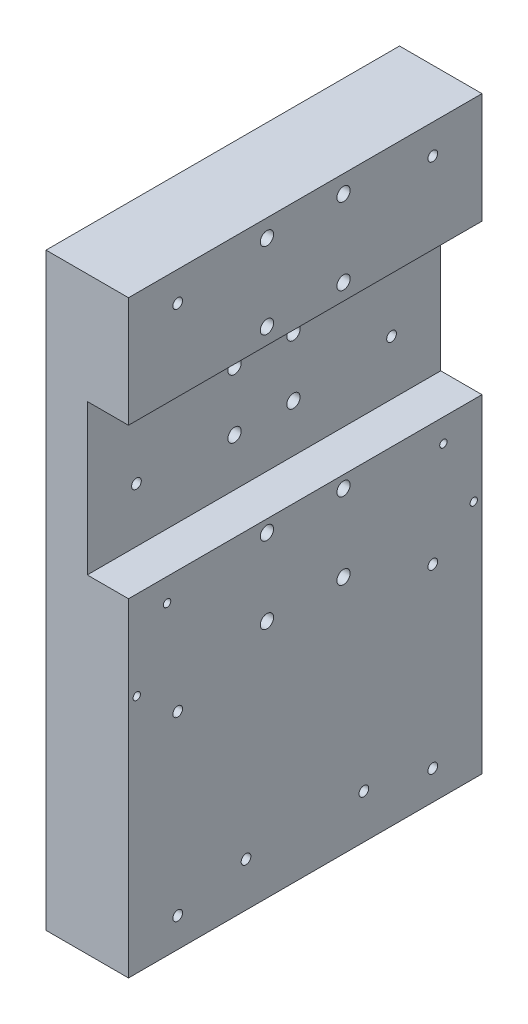
from build123d import *

# Parameters (mm, degrees)
BOSS_EXTRUDE1_DEPTH            = 120
CBORE_FOR_M4_SHCS4_D           = 4.5
CBORE_FOR_M4_SHCS4_CBORE_D     = 8
CBORE_FOR_M4_SHCS4_CBORE_DEPTH = 4
M4_TAPPED_HOLE1_D              = 3.3
M5_TAPPED_HOLE1_D              = 4.2
M5_TAPPED_HOLE1_DEPTH          = 17.4
M5_TAPPED_HOLE1_TIP            = 1.2618073
M4_TAPPED_HOLE2_D              = 3.3
M3_TAPPED_HOLE2_D              = 2.5
M3_TAPPED_HOLE2_DEPTH          = 11.5
M3_TAPPED_HOLE2_TIP            = 0.751075774


with BuildPart() as part:
    # Sketch1 → Boss-Extrude1 (new body)
    with BuildSketch(Plane.XY):
        Polygon((0, 0), (0, 200), (28, 200), (28, 162.5), (14, 162.5), (14, 111.5), (28, 111.5), (28, 0), align=None)
    extrude(amount=BOSS_EXTRUDE1_DEPTH)

    # CBORE for M4 SHCS4 (through all)
    with Locations(Plane(origin=(0, 194, 73), x_dir=(0, 0, -1), z_dir=(-1, 0, 0))):
        with Locations((0, 0), (0, 26), (3, 46.3), (3, 66.3), (0, 86.6), (0, 112.6), (26, 112.6), (26, 86.6), (23, 66.3), (23, 46.3), (26, 26), (26, 0)):
            CounterBoreHole(CBORE_FOR_M4_SHCS4_D / 2, CBORE_FOR_M4_SHCS4_CBORE_D / 2, CBORE_FOR_M4_SHCS4_CBORE_DEPTH)

    # M4 Tapped Hole1 (through all)
    with Locations(Plane(origin=(0, 190, 16.7), x_dir=(0, 0, -1), z_dir=(-1, 0, 0))):
        with Locations((0, 0), (0, 60), (0, 120), (0, 180), (-86.6, 180), (-86.6, 120), (-86.6, 60), (-86.6, 0)):
            Hole(M4_TAPPED_HOLE1_D / 2)

    # M5 Tapped Hole1
    with Locations(Plane(origin=(14, 0, 90), x_dir=(-1, 0, 0), z_dir=(0, -1, 0))):
        with Locations((0, 0), (0, 30), (0, 60)):
            Hole(M5_TAPPED_HOLE1_D / 2, depth=M5_TAPPED_HOLE1_DEPTH)
            with Locations((0, 0, -(M5_TAPPED_HOLE1_DEPTH + M5_TAPPED_HOLE1_TIP / 2))):  # 118° drill point
                Cone(0, M5_TAPPED_HOLE1_D / 2, M5_TAPPED_HOLE1_TIP, mode=Mode.SUBTRACT)

    # M4 Tapped Hole2 (through all)
    with Locations(Plane(origin=(28, 15, 80.1), x_dir=(0, 1, 0), z_dir=(1, 0, 0))):
        with Locations((0, 0), (0, -40)):
            Hole(M4_TAPPED_HOLE2_D / 2)

    # M3 Tapped Hole2
    with Locations(Plane(origin=(28, 103.660435599, 106.9), x_dir=(0, 1, 0), z_dir=(1, 0, 0))):
        with Locations((0, 0), (-22.2, 10.3), (0, -93.8), (-22.2, -104.1)):
            Hole(M3_TAPPED_HOLE2_D / 2, depth=M3_TAPPED_HOLE2_DEPTH)
            with Locations((0, 0, -(M3_TAPPED_HOLE2_DEPTH + M3_TAPPED_HOLE2_TIP / 2))):  # 118° drill point
                Cone(0, M3_TAPPED_HOLE2_D / 2, M3_TAPPED_HOLE2_TIP, mode=Mode.SUBTRACT)


solid = part.part
